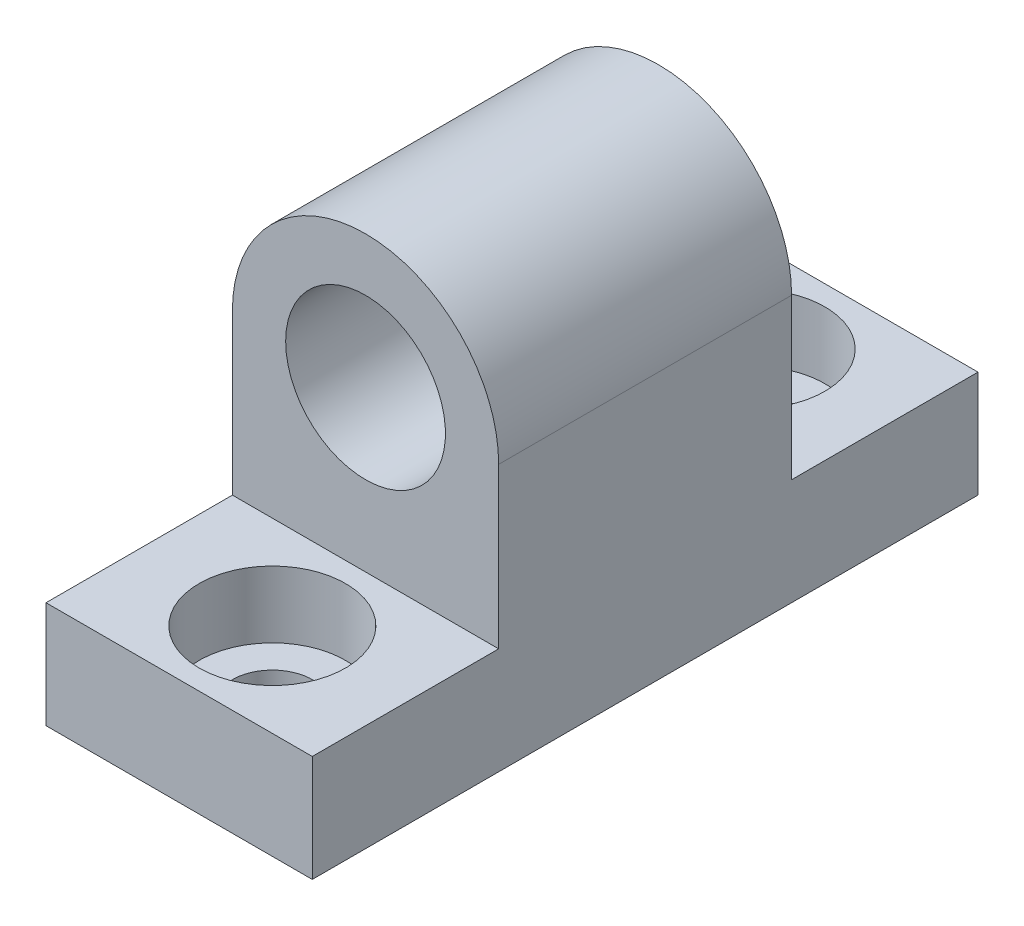
from build123d import *

# Parameters (mm, degrees)
SKETCH_1_R               = 6
EXTRUDE_1_DEPTH          = 25
CUT_EXTRUDE_1_DEPTH      = 41.311288741
CUT_EXTRUDE_1_DEPTH_BACK = 41.311288741
SKETCH_2_W               = 21.902921801
SKETCH_2_H               = 31.191688498
SKETCH_2_W_2             = 23.513880173
SKETCH_2_H_2             = 33.775615356
CUT_EXTRUDE_2_REACH      = 45.875
SKETCH_3_R               = 2.5
SKETCH_4_R               = 3
CUT_EXTRUDE_3_DEPTH      = 12
SKETCH_5_R               = 5.5
CUT_EXTRUDE_4_DEPTH      = 5
SKETCH_6_R               = 3
CUT_EXTRUDE_5_DEPTH      = 39.131352027


with BuildPart() as part:
    # Эскиз1 → Бобышка-Вытянуть1 (new, symmetric)
    with BuildSketch(Plane.XY):
        with BuildLine():
            Line((-10, 0), (10, 0))
            Line((10, 0), (10, 20))
            ThreePointArc((10, 20), (0, 30), (-10, 20))
            Line((-10, 20), (-10, 0))
        make_face()
        with Locations((0, 20)):
            Circle(SKETCH_1_R, mode=Mode.SUBTRACT)
    extrude(amount=EXTRUDE_1_DEPTH, both=True)

    # Эскиз2 → Вырез-Вытянуть1 (cut, two sides: drawn at the far end of the back side and taken through both)
    with BuildSketch(Plane(origin=(0, 0, 0), x_dir=(0, 0, -1), z_dir=(1, 0, 0)).offset(-CUT_EXTRUDE_1_DEPTH_BACK)):
        with Locations((21.951460901, 23.595844249)):
            Rectangle(SKETCH_2_W, SKETCH_2_H)
        with Locations((-22.756940087, 24.887807678)):
            Rectangle(SKETCH_2_W_2, SKETCH_2_H_2)
    extrude(amount=CUT_EXTRUDE_1_DEPTH + CUT_EXTRUDE_1_DEPTH_BACK, mode=Mode.SUBTRACT)

    # Эскиз3 → Вырез-Вытянуть2 (cut, up to next)
    with BuildSketch(Plane.ZY.offset(10), mode=Mode.PRIVATE) as cut_extrude_2_sk1:
        with Locations((0, 20)):
            Circle(SKETCH_3_R)
    cut_extrude_2_tool1 = extrude(cut_extrude_2_sk1.sketch, amount=-CUT_EXTRUDE_2_REACH, mode=Mode.PRIVATE) & part.part
    add(cut_extrude_2_tool1.solids().sort_by_distance((-10, 20, 0))[0], mode=Mode.SUBTRACT)

    # Эскиз4 → Вырез-Вытянуть3 (cut)
    with BuildSketch(Plane(origin=(0, 0, 0), x_dir=(-1, 0, 0), z_dir=(0, -1, 0))):
        Circle(SKETCH_4_R)
    extrude(amount=-CUT_EXTRUDE_3_DEPTH, mode=Mode.SUBTRACT)

    # Эскиз5 → Вырез-Вытянуть4 (cut)
    with BuildSketch(Plane(origin=(0, 8, 0), x_dir=(1, 0, 0), z_dir=(0, 1, 0))):
        with Locations((0, 18)):
            Circle(SKETCH_5_R)
        with Locations((0, -18)):
            Circle(SKETCH_5_R)
    extrude(amount=-CUT_EXTRUDE_4_DEPTH, mode=Mode.SUBTRACT)

    # Эскиз6 → Вырез-Вытянуть5 (cut, through all)
    with BuildSketch(Plane(origin=(0, 3, 0), x_dir=(1, 0, 0), z_dir=(0, 1, 0))):
        with Locations((0, 18)):
            Circle(SKETCH_6_R)
        with Locations((0, -18)):
            Circle(SKETCH_6_R)
    extrude(amount=-CUT_EXTRUDE_5_DEPTH, mode=Mode.SUBTRACT)


solid = part.part
